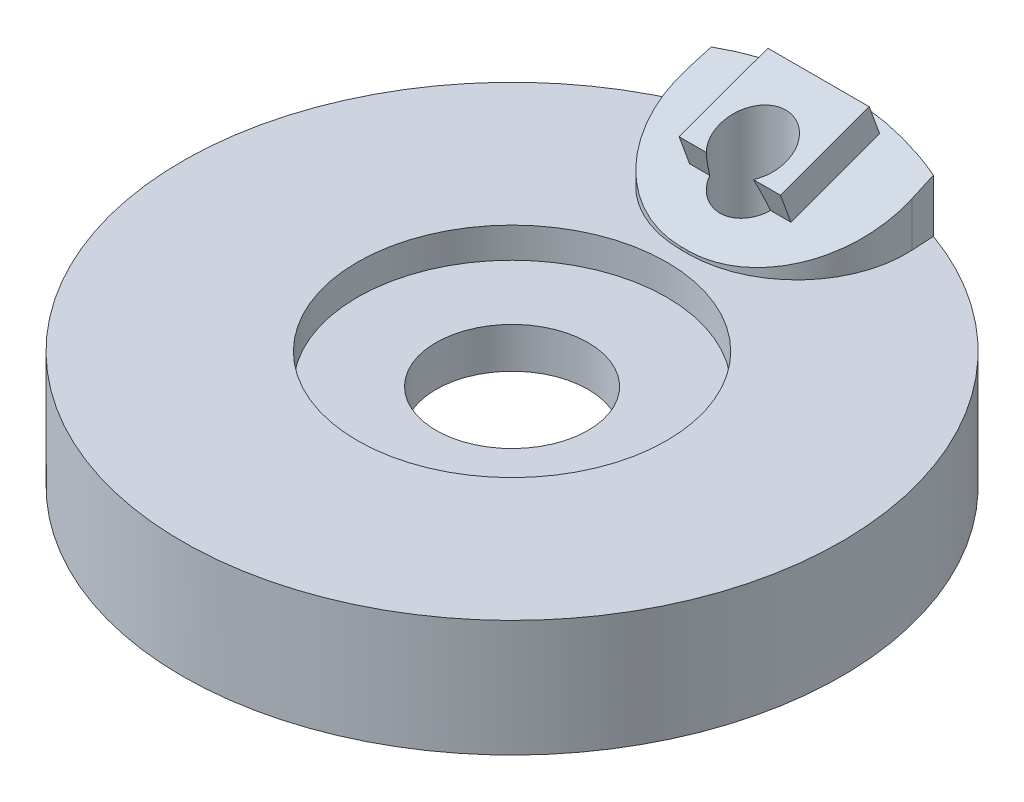
from build123d import *

# Parameters (mm, degrees)
BOSS_EXTRUDE1_START  = 47.2
SKETCH1_R            = 13
BOSS_EXTRUDE1_DEPTH  = 4.6
BOSS_EXTRUDE2_START  = -5.5
BOSS_EXTRUDE2_DEPTH  = 11
BOSS_EXTRUDE3_START  = -2
BOSS_EXTRUDE3_DEPTH  = 4
BOSS_EXTRUDE4_START  = 51.8
SKETCH4_R            = 25
SKETCH4_R_2          = 13
BOSS_EXTRUDE4_DEPTH  = 6.2
BOSS_EXTRUDE5_START  = 51.8
SKETCH5_W            = 40
SKETCH5_H            = 100
BOSS_EXTRUDE5_DEPTH  = 6.2
BOSS_EXTRUDE6_START  = 46.7
BOSS_EXTRUDE6_DEPTH  = 2.3
BOSS_EXTRUDE7_START  = 46.7
BOSS_EXTRUDE7_DEPTH  = 2.3
BOSS_EXTRUDE8_START  = 46.7
SKETCH8_R            = 4.6
BOSS_EXTRUDE8_DEPTH  = 2.3
BOSS_EXTRUDE9_START  = 48.9
SKETCH9_R            = 3
BOSS_EXTRUDE9_DEPTH  = 1.8
BOSS_EXTRUDE10_START = 50.6
SKETCH10_R           = 6.1
BOSS_EXTRUDE10_DEPTH = 1.7
BOSS_EXTRUDE11_START = 48.9
BOSS_EXTRUDE11_DEPTH = 1.9
BOSS_EXTRUDE12_START = 48.9
BOSS_EXTRUDE12_DEPTH = 1.9
BOSS_EXTRUDE13_START = 48.9
BOSS_EXTRUDE13_DEPTH = 1.9
BOSS_EXTRUDE14_START = 48.9
BOSS_EXTRUDE14_DEPTH = 1.9
BOSS_EXTRUDE15_START = 47.1
SKETCH15_R           = 2.2
BOSS_EXTRUDE15_DEPTH = 1.9
BOSS_EXTRUDE16_START = 48.9
SKETCH16_R           = 1.3
BOSS_EXTRUDE16_DEPTH = 9.1


with BuildPart() as part:
    # Sketch1 → Boss-Extrude1 (new body)
    with BuildSketch(Plane(origin=(0, 0, 0), x_dir=(1, 0, 0), z_dir=(0, 1, 0)).offset(BOSS_EXTRUDE1_START)):
        with Locations((0, 62)):
            Circle(SKETCH1_R)
    extrude(amount=BOSS_EXTRUDE1_DEPTH)

    # Sketch2 → Boss-Extrude2 (add)
    with BuildSketch(Plane(origin=(0, 0, 0), x_dir=(0, 0, -1), z_dir=(1, 0, 0)).offset(BOSS_EXTRUDE2_START)):
        Polygon((68.5, 51.8), (76.5, 51.8), (76.5, 54.711761874), align=None)
    extrude(amount=BOSS_EXTRUDE2_DEPTH)

    # Sketch3 → Boss-Extrude3 (add)
    with BuildSketch(Plane(origin=(0, 0, 0), x_dir=(0, 0, -1), z_dir=(1, 0, 0)).offset(BOSS_EXTRUDE3_START)):
        Polygon((71.017101007, 52.662940955), (74.517101007, 53.936836775), (74.089575828, 55.111452551), (70.589575828, 53.837556731), align=None)
    extrude(amount=BOSS_EXTRUDE3_DEPTH)


with BuildPart() as body_2:
    # Sketch4 → Boss-Extrude4 (new body)
    with BuildSketch(Plane(origin=(0, 0, 0), x_dir=(1, 0, 0), z_dir=(0, 1, 0)).offset(BOSS_EXTRUDE4_START)):
        with Locations((0, 62)):
            Circle(SKETCH4_R)
        with Locations((0, 62)):
            Circle(SKETCH4_R_2, mode=Mode.SUBTRACT)
    extrude(amount=BOSS_EXTRUDE4_DEPTH)


with BuildPart() as part_1:
    add(part.part)

    # Combine1: cut body 2
    add(body_2.part, mode=Mode.SUBTRACT)


with BuildPart() as body_2_2:
    # Sketch5 → Boss-Extrude5 (new body)
    with BuildSketch(Plane(origin=(0, 0, 0), x_dir=(1, 0, 0), z_dir=(0, 1, 0)).offset(BOSS_EXTRUDE5_START)):
        with Locations((0, 90)):
            Rectangle(SKETCH5_W, SKETCH5_H)
        with BuildLine():
            Line((-0.141041229, 68.8), (0.141041229, 68.8))
            ThreePointArc((0.141041229, 68.8), (3.2691437, 70.149580551), (4.433699076, 73.351174452))
            Line((4.433699076, 73.351174452), (2.310189394, 109.642685883))
            ThreePointArc((2.310189394, 109.642685883), (1.685892465, 110.980791938), (0.313604349, 111.525860556))
            Line((0.313604349, 111.525860556), (-0.313604349, 111.525860556))
            ThreePointArc((-0.313604349, 111.525860556), (-1.685892465, 110.980791938), (-2.310189394, 109.642685883))
            Line((-2.310189394, 109.642685883), (-4.433699076, 73.351174452))
            ThreePointArc((-4.433699076, 73.351174452), (-3.2691437, 70.149580551), (-0.141041229, 68.8))
        make_face(mode=Mode.SUBTRACT)
    extrude(amount=BOSS_EXTRUDE5_DEPTH)


with BuildPart() as part_2:
    add(part_1.part)

    # Combine2: cut body 2 2
    add(body_2_2.part, mode=Mode.SUBTRACT)


with BuildPart() as body_2_3:
    # Sketch6 → Boss-Extrude6 (new body)
    with BuildSketch(Plane(origin=(0, 0, 0), x_dir=(1, 0, 0), z_dir=(0, 1, 0)).offset(BOSS_EXTRUDE6_START)):
        Polygon((-5.798275606, 72.465180362), (10.465180362, 56.201724394), (5.798275606, 51.534819638), (-10.465180362, 67.798275606), align=None)
    extrude(amount=BOSS_EXTRUDE6_DEPTH)


with BuildPart() as part_3:
    add(part_2.part)

    # Combine3: cut body 2 3
    add(body_2_3.part, mode=Mode.SUBTRACT)


with BuildPart() as body_2_4:
    # Sketch7 → Boss-Extrude7 (new body)
    with BuildSketch(Plane(origin=(0, 0, 0), x_dir=(1, 0, 0), z_dir=(0, 1, 0)).offset(BOSS_EXTRUDE7_START)):
        Polygon((10.465180362, 67.798275606), (-5.798275606, 51.534819638), (-10.465180362, 56.201724394), (5.798275606, 72.465180362), align=None)
    extrude(amount=BOSS_EXTRUDE7_DEPTH)


with BuildPart() as part_4:
    add(part_3.part)

    # Combine4: cut body 2 4
    add(body_2_4.part, mode=Mode.SUBTRACT)


with BuildPart() as body_2_5:
    # Sketch8 → Boss-Extrude8 (new body)
    with BuildSketch(Plane(origin=(0, 0, 0), x_dir=(1, 0, 0), z_dir=(0, 1, 0)).offset(BOSS_EXTRUDE8_START)):
        with Locations((0, 62)):
            Circle(SKETCH8_R)
    extrude(amount=BOSS_EXTRUDE8_DEPTH)


with BuildPart() as part_5:
    add(part_4.part)

    # Combine5: cut body 2 5
    add(body_2_5.part, mode=Mode.SUBTRACT)


with BuildPart() as body_2_6:
    # Sketch9 → Boss-Extrude9 (new body)
    with BuildSketch(Plane(origin=(0, 0, 0), x_dir=(1, 0, 0), z_dir=(0, 1, 0)).offset(BOSS_EXTRUDE9_START)):
        with Locations((0, 62)):
            Circle(SKETCH9_R)
    extrude(amount=BOSS_EXTRUDE9_DEPTH)


with BuildPart() as part_6:
    add(part_5.part)

    # Combine6: cut body 2 6
    add(body_2_6.part, mode=Mode.SUBTRACT)


with BuildPart() as body_2_7:
    # Sketch10 → Boss-Extrude10 (new body)
    with BuildSketch(Plane(origin=(0, 0, 0), x_dir=(1, 0, 0), z_dir=(0, 1, 0)).offset(BOSS_EXTRUDE10_START)):
        with Locations((0, 62)):
            Circle(SKETCH10_R)
    extrude(amount=BOSS_EXTRUDE10_DEPTH)


with BuildPart() as part_7:
    add(part_6.part)

    # Combine7: cut body 2 7
    add(body_2_7.part, mode=Mode.SUBTRACT)


with BuildPart() as body_2_8:
    # Sketch11 → Boss-Extrude11 (new body)
    with BuildSketch(Plane(origin=(0, 0, 0), x_dir=(1, 0, 0), z_dir=(0, 1, 0)).offset(BOSS_EXTRUDE11_START)):
        Polygon((5.374011537, 57.898780669), (7.707463915, 55.565328291), (6.434671709, 54.292536085), (4.101219331, 56.625988463), align=None)
    extrude(amount=BOSS_EXTRUDE11_DEPTH)


with BuildPart() as part_8:
    add(part_7.part)

    # Combine8: cut body 2 8
    add(body_2_8.part, mode=Mode.SUBTRACT)


with BuildPart() as body_2_9:
    # Sketch12 → Boss-Extrude12 (new body)
    with BuildSketch(Plane(origin=(0, 0, 0), x_dir=(1, 0, 0), z_dir=(0, 1, 0)).offset(BOSS_EXTRUDE12_START)):
        Polygon((-4.101219331, 56.625988463), (-6.434671709, 54.292536085), (-7.707463915, 55.565328291), (-5.374011537, 57.898780669), align=None)
    extrude(amount=BOSS_EXTRUDE12_DEPTH)


with BuildPart() as part_9:
    add(part_8.part)

    # Combine9: cut body 2 9
    add(body_2_9.part, mode=Mode.SUBTRACT)


with BuildPart() as body_2_10:
    # Sketch13 → Boss-Extrude13 (new body)
    with BuildSketch(Plane(origin=(0, 0, 0), x_dir=(1, 0, 0), z_dir=(0, 1, 0)).offset(BOSS_EXTRUDE13_START)):
        Polygon((-5.374011537, 66.101219331), (-7.707463915, 68.434671709), (-6.434671709, 69.707463915), (-4.101219331, 67.374011537), align=None)
    extrude(amount=BOSS_EXTRUDE13_DEPTH)


with BuildPart() as part_10:
    add(part_9.part)

    # Combine10: cut body 2 10
    add(body_2_10.part, mode=Mode.SUBTRACT)


with BuildPart() as body_2_11:
    # Sketch14 → Boss-Extrude14 (new body)
    with BuildSketch(Plane(origin=(0, 0, 0), x_dir=(1, 0, 0), z_dir=(0, 1, 0)).offset(BOSS_EXTRUDE14_START)):
        Polygon((4.101219331, 67.374011537), (6.434671709, 69.707463915), (7.707463915, 68.434671709), (5.374011537, 66.101219331), align=None)
    extrude(amount=BOSS_EXTRUDE14_DEPTH)


with BuildPart() as part_11:
    add(part_10.part)

    # Combine11: cut body 2 11
    add(body_2_11.part, mode=Mode.SUBTRACT)


with BuildPart() as body_2_12:
    # Sketch15 → Boss-Extrude15 (new body)
    with BuildSketch(Plane(origin=(0, 0, 0), x_dir=(1, 0, 0), z_dir=(0, 1, 0)).offset(BOSS_EXTRUDE15_START)):
        with Locations((0, 71.5)):
            Circle(SKETCH15_R)
    extrude(amount=BOSS_EXTRUDE15_DEPTH)


with BuildPart() as part_12:
    add(part_11.part)

    # Combine12: cut body 2 12
    add(body_2_12.part, mode=Mode.SUBTRACT)


with BuildPart() as body_2_13:
    # Sketch16 → Boss-Extrude16 (new body)
    with BuildSketch(Plane(origin=(0, 0, 0), x_dir=(1, 0, 0), z_dir=(0, 1, 0)).offset(BOSS_EXTRUDE16_START)):
        with Locations((0, 71.5)):
            Circle(SKETCH16_R)
    extrude(amount=BOSS_EXTRUDE16_DEPTH)


with BuildPart() as part_13:
    add(part_12.part)

    # Combine13: cut body 2 13
    add(body_2_13.part, mode=Mode.SUBTRACT)


solid = part_13.part
